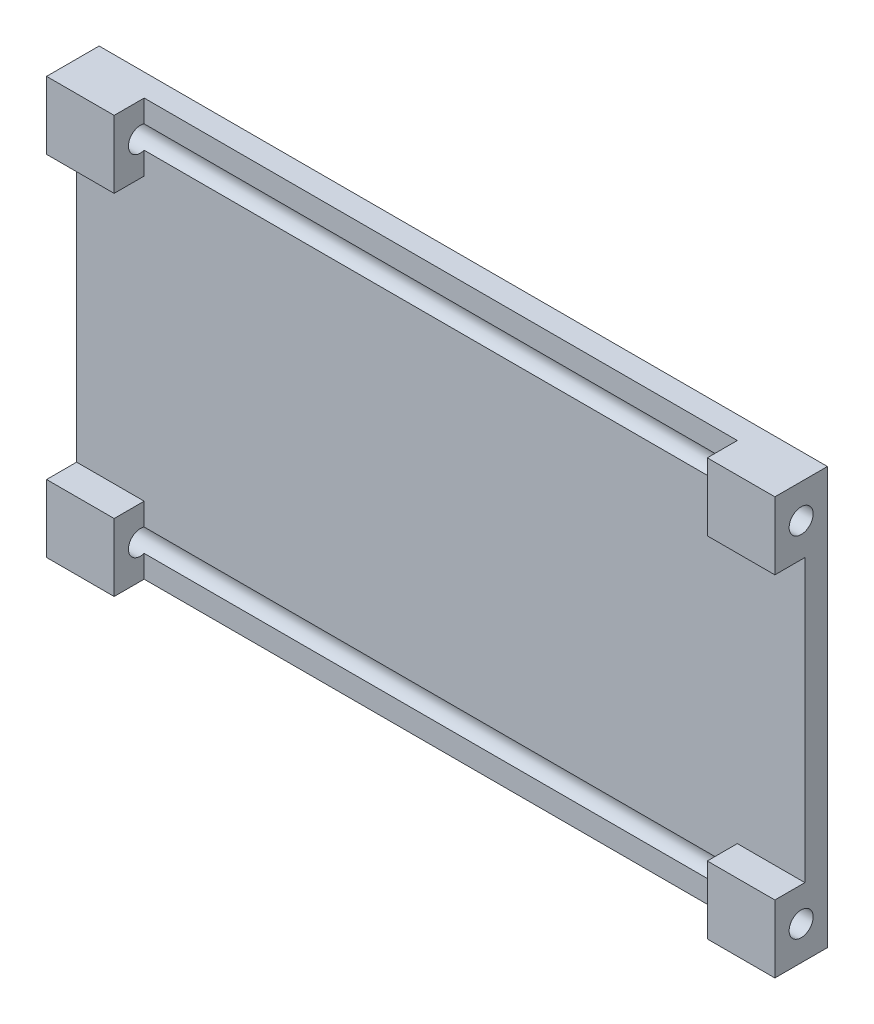
from build123d import *

# Parameters (mm, degrees)
CROQUIS1_W              = 97
CROQUIS1_H              = 55.5
SALIENTE_EXTRUIR1_DEPTH = 3
CROQUIS2_W              = 9
CROQUIS2_H              = 9
SALIENTE_EXTRUIR2_DEPTH = 4
CROQUIS3_R              = 1.6
CORTAR_EXTRUIR1_DEPTH   = 101.970602157


with BuildPart() as part:
    # Croquis1 → Saliente-Extruir1 (new body)
    with BuildSketch(Plane.XY):
        Rectangle(CROQUIS1_W, CROQUIS1_H)
    extrude(amount=-SALIENTE_EXTRUIR1_DEPTH)

    # Croquis2 → Saliente-Extruir2 (add)
    with BuildSketch(Plane.XY):
        with Locations((-44, 23.25)):
            Rectangle(CROQUIS2_W, CROQUIS2_H)
        with Locations((-44, -23.25)):
            Rectangle(CROQUIS2_W, CROQUIS2_H)
        with Locations((44, -23.25)):
            Rectangle(CROQUIS2_W, CROQUIS2_H)
        with Locations((44, 23.25)):
            Rectangle(CROQUIS2_W, CROQUIS2_H)
    extrude(amount=SALIENTE_EXTRUIR2_DEPTH)

    # Croquis3 → Cortar-Extruir1 (cut, through all)
    with BuildSketch(Plane.ZY.offset(48.5)):
        with Locations((0.5, 23.25)):
            Circle(CROQUIS3_R)
        with Locations((0.5, -23.25)):
            Circle(CROQUIS3_R)
    extrude(amount=-CORTAR_EXTRUIR1_DEPTH, mode=Mode.SUBTRACT)


solid = part.part
